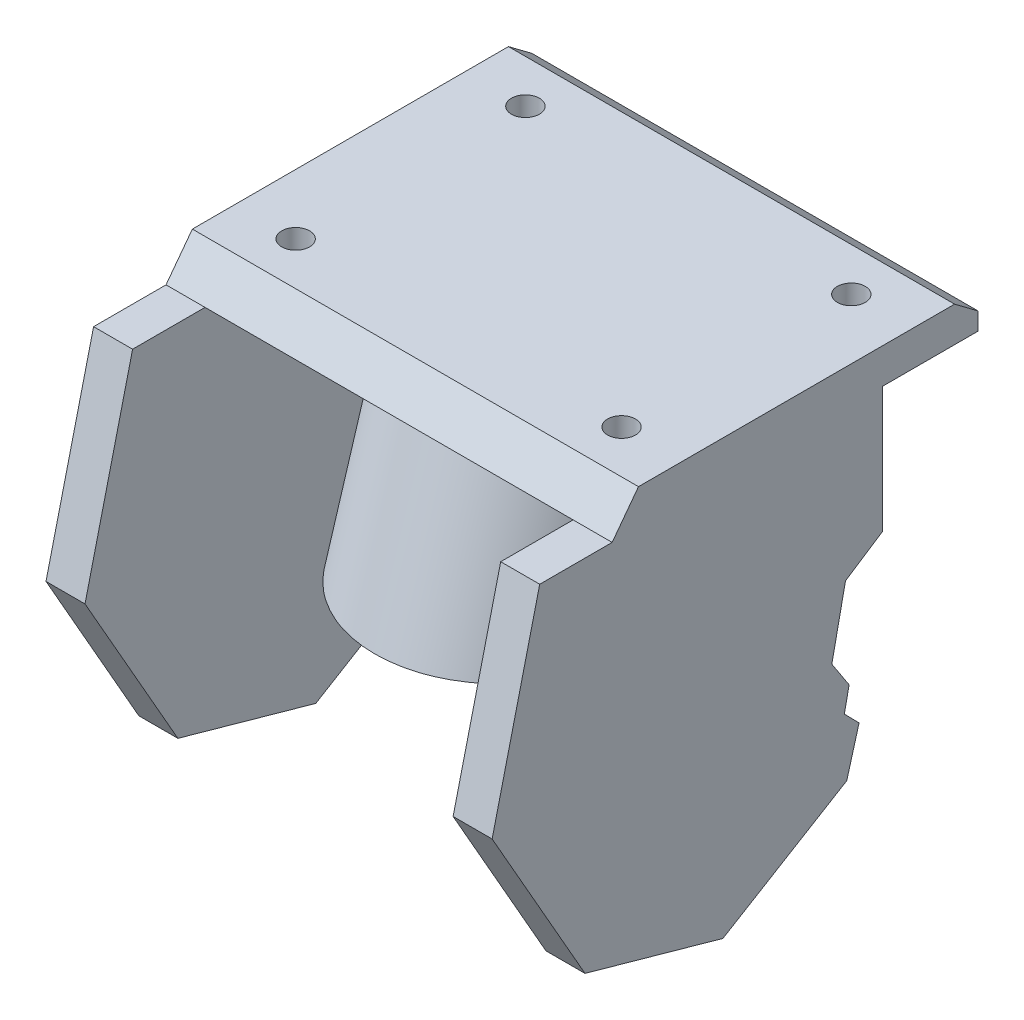
from build123d import *

# Parameters (mm, degrees)
SKETCH3_W               = 26.402815354
SKETCH3_H               = 30.166458461
CUT_EXTRUDE1_DEPTH      = 47
SKETCH4_R               = 1
CUT_EXTRUDE3_DEPTH      = 47
MIRROR4_COPY_1_SKETCH_R = 1
MIRROR4_COPY_1_DEPTH    = 47


with BuildPart() as part:
    # Sketch2 → Loft1 section 0
    with BuildSketch(Plane(origin=(32, 0, 0), x_dir=(0, 0, -1), z_dir=(1, 0, 0))):
        with BuildLine():
            Line((0, 14.455895325), (3.413030344, 28.573993623))
            Line((3.413030344, 28.573993623), (8.608910386, 28.573993623))
            Line((8.608910386, 28.573993623), (10.498321311, 31.093208189))
            Line((10.498321311, 31.093208189), (33.171252407, 31.093208189))
            Line((33.171252407, 31.093208189), (34.850728784, 29.833600906))
            Line((34.850728784, 29.833600906), (34.850728784, 28.573993623))
            Line((34.850728784, 28.573993623), (28.015283486, 28.573993623))
            Line((28.015283486, 28.573993623), (28.015283486, 19.565154633))
            Line((28.015283486, 19.565154633), (25.347572315, 17.820529869))
            Line((25.347572315, 17.820529869), (24.366204042, 13.129607698))
            Line((24.366204042, 13.129607698), (25.607594247, 11.231394061))
            Line((25.607594247, 11.231394061), (25.263551475, 9.586875986))
            Line((25.263551475, 9.586875986), (26.31991204, 8.508154932))
            Line((26.31991204, 8.508154932), (25.435572861, 5.355231962))
            Line((25.435572861, 5.355231962), (16.552703214, 0))
            Line((16.552703214, 0), (6.661783172, 2.774228292))
            Line((6.661783172, 2.774228292), (0, 14.455895325))
        make_face()
    # Sketch1 → Loft1 section 1
    with BuildSketch(Plane(origin=(0, 0, 0), x_dir=(0, 0, -1), z_dir=(1, 0, 0))):
        with BuildLine():
            Line((0, 14.455895325), (3.413030344, 28.573993623))
            Line((3.413030344, 28.573993623), (8.608910386, 28.573993623))
            Line((8.608910386, 28.573993623), (10.498321311, 31.093208189))
            Line((10.498321311, 31.093208189), (33.171252407, 31.093208189))
            Line((33.171252407, 31.093208189), (34.850728784, 29.833600906))
            Line((34.850728784, 29.833600906), (34.850728784, 28.573993623))
            Line((34.850728784, 28.573993623), (28.015283486, 28.573993623))
            Line((28.015283486, 28.573993623), (28.015283486, 19.565154633))
            Line((28.015283486, 19.565154633), (25.347572315, 17.820529869))
            Line((25.347572315, 17.820529869), (24.366204042, 13.129607698))
            Line((24.366204042, 13.129607698), (25.607594247, 11.231394061))
            Line((25.607594247, 11.231394061), (25.263551475, 9.586875986))
            Line((25.263551475, 9.586875986), (26.31991204, 8.508154932))
            Line((26.31991204, 8.508154932), (25.435572861, 5.355231962))
            Line((25.435572861, 5.355231962), (16.552703214, 0))
            Line((16.552703214, 0), (6.661783172, 2.774228292))
            Line((6.661783172, 2.774228292), (0, 14.455895325))
        make_face()
    loft()

    # Sketch3 → Cut-Extrude1 (cut)
    with BuildSketch(Plane.XY):
        with Locations((16, 13.490764393)):
            Rectangle(SKETCH3_W, SKETCH3_H)
    extrude(amount=-CUT_EXTRUDE1_DEPTH, mode=Mode.SUBTRACT)

    # Sketch4 → Cut-Extrude3 (cut)
    with BuildSketch(Plane(origin=(0, 31.093208189, 0), x_dir=(1, 0, 0), z_dir=(0, 1, 0))):
        with Locations((4.311005364, 30.074777425)):
            Circle(SKETCH4_R)
    cut_extrude3 = extrude(amount=-CUT_EXTRUDE3_DEPTH, mode=Mode.SUBTRACT)

    # Mirror3: Cut-Extrude3 across plane
    add(cut_extrude3.mirror(Plane(origin=(16, 0, 0), x_dir=(0, 0, 1), z_dir=(1, 0, 0))), mode=Mode.SUBTRACT)

    # Mirror4: Cut-Extrude3 across plane
    add(cut_extrude3.mirror(Plane.XY.offset(-21.834786859)), mode=Mode.SUBTRACT)

    # Mirror4 copy 1 sketch → Mirror4 copy 1 (cut)
    with BuildSketch(Plane(origin=(32, 31.093208189, -43.669573718), x_dir=(-1, 0, 0), z_dir=(0, 1, 0))):
        with Locations((4.311005364, 30.074777425)):
            Circle(MIRROR4_COPY_1_SKETCH_R)
    extrude(amount=-MIRROR4_COPY_1_DEPTH, mode=Mode.SUBTRACT)

    # Sketch6 → Loft2 section 0
    with BuildSketch(Plane(origin=(0, 14.288993623, 0), x_dir=(-1, 0, 0), z_dir=(0, -1, 0))):
        with BuildLine():
            Line((-9.018092228, 19.761600579), (-7.95240346, 20.196945779))
            ThreePointArc((-7.95240346, 20.196945779), (-16.127321048, 7.452302301), (-24.302238636, 20.196945779))
            Line((-24.302238636, 20.196945779), (-23.236549868, 19.761600579))
            ThreePointArc((-23.236549868, 19.761600579), (-16.127321048, 9.032071449), (-9.018092228, 19.761600579))
        make_face()
    # Sketch5 → Loft2 section 1
    with BuildSketch(Plane(origin=(0, 28.573993623, 0), x_dir=(-1, 0, 0), z_dir=(0, -1, 0))):
        with BuildLine():
            Line((-9.018092228, 24.112821073), (-7.95240346, 24.548166273))
            ThreePointArc((-7.95240346, 24.548166273), (-16.127321048, 11.803522795), (-24.302238636, 24.548166273))
            Line((-24.302238636, 24.548166273), (-23.236549868, 24.112821073))
            ThreePointArc((-23.236549868, 24.112821073), (-16.127321048, 13.383291944), (-9.018092228, 24.112821073))
        make_face()
    loft()


solid = part.part
